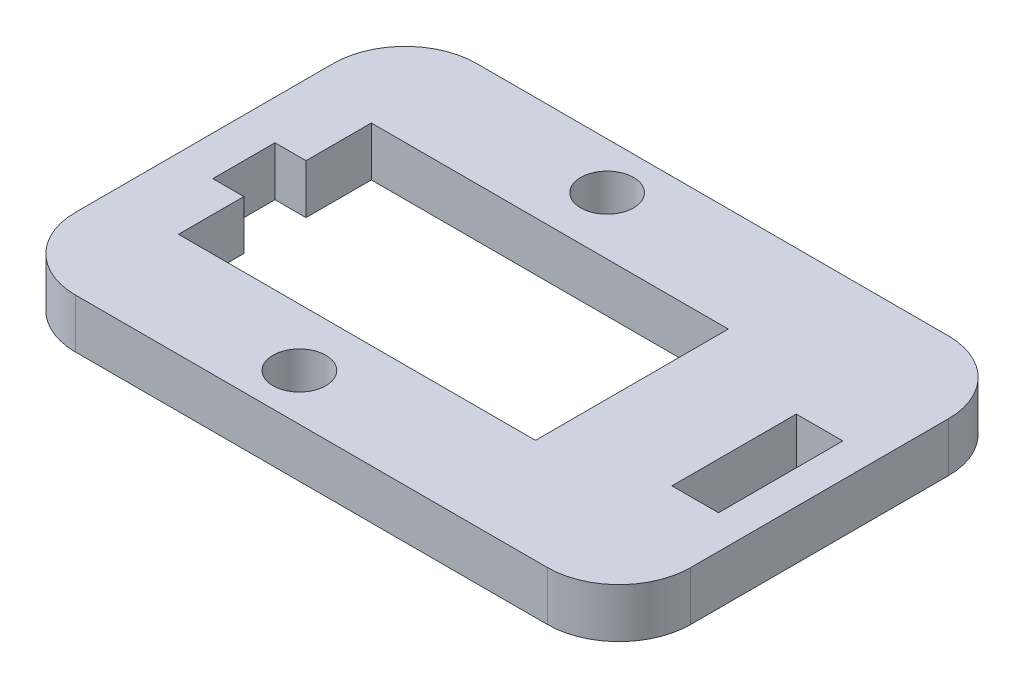
from build123d import *

# Parameters (mm, degrees)
SKETCH1_R           = 1.7
SKETCH1_W           = 2.995
SKETCH1_H           = 8
BOSS_EXTRUDE1_DEPTH = 3.175


with BuildPart() as part:
    # Sketch1 → Boss-Extrude1 (new body)
    with BuildSketch(Plane(origin=(0, 0, 0), x_dir=(1, 0, 0), z_dir=(0, 1, 0))):
        with BuildLine():
            Line((-17.853850258, 15.178456504), (12.496387942, 15.178456504))
            ThreePointArc((12.496387942, 15.178456504), (15.756065987, 13.828253648), (17.106268842, 10.568575603))
            Line((17.106268842, 10.568575603), (17.106268842, -6.010662596))
            ThreePointArc((17.106268842, -6.010662596), (15.756065987, -9.270340641), (12.496387942, -10.620543496))
            Line((12.496387942, -10.620543496), (-17.853850258, -10.620543496))
            ThreePointArc((-17.853850258, -10.620543496), (-21.113528303, -9.270340641), (-22.463731158, -6.010662596))
            Line((-22.463731158, -6.010662596), (-22.463731158, 10.568575603))
            ThreePointArc((-22.463731158, 10.568575603), (-21.113528303, 13.828253648), (-17.853850258, 15.178456504))
        make_face()
        with Locations((-6.461731158, 12.179456504)):
            Circle(SKETCH1_R, mode=Mode.SUBTRACT)
        with Locations((-6.452983034, -7.621541564)):
            Circle(SKETCH1_R, mode=Mode.SUBTRACT)
        Polygon((-17.927731159, 8.479456549), (5.031268841, 8.479456549), (5.031268841, -3.921543451), (-17.927731159, -3.921543451), (-17.927731159, 0.279553073), (-19.923731158, 0.279553073), (-19.923731158, 4.278360025), (-17.927731159, 4.278360025), align=None, mode=Mode.SUBTRACT)
        with Locations((13.451768841, 1.932456504)):
            Rectangle(SKETCH1_W, SKETCH1_H, mode=Mode.SUBTRACT)
    extrude(amount=BOSS_EXTRUDE1_DEPTH)


solid = part.part
